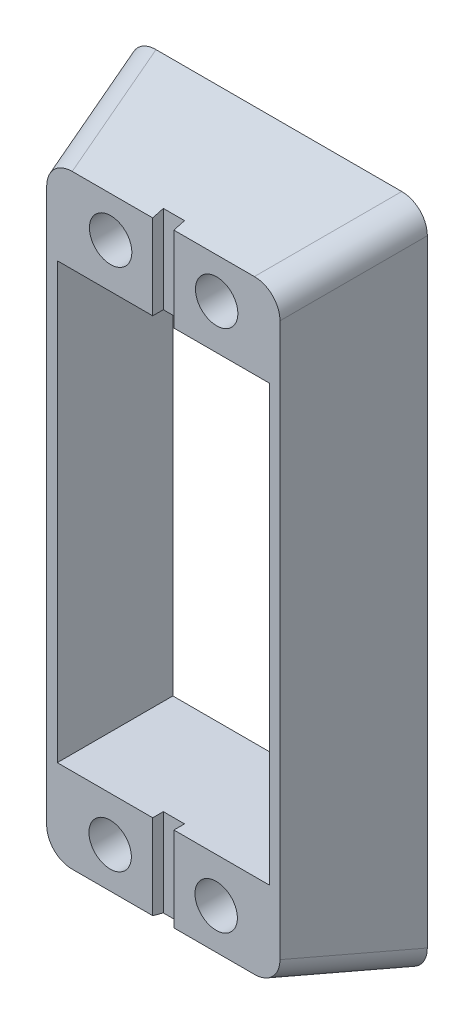
from build123d import *

# Parameters (mm, degrees)
SKETCH1_W           = 28
SKETCH1_H           = 63
SKETCH1_W_2         = 20
SKETCH1_H_2         = 41
BOSS_EXTRUDE1_DEPTH = 10.9
SKETCH2_R           = 2
CUT_EXTRUDE1_DEPTH  = 45.904036567
CHAMFER1_SIZE       = 10.9
CHAMFER1_SIZE_2     = 3
SKETCH3_W           = 2
SKETCH3_H           = 1
CUT_EXTRUDE2_DEPTH  = 65.248521384
FILLET1_R           = 2.5


with BuildPart() as part:
    # Sketch1 → Boss-Extrude1 (new body)
    with BuildSketch(Plane.XY):
        with Locations((0, 9.75)):
            Rectangle(SKETCH1_W, SKETCH1_H)
        with Locations((0, 9.75)):
            Rectangle(SKETCH1_W_2, SKETCH1_H_2, mode=Mode.SUBTRACT)
    extrude(amount=BOSS_EXTRUDE1_DEPTH)

    # Sketch2 → Cut-Extrude1 (cut, through all)
    with BuildSketch(Plane(origin=(0, 0, 0), x_dir=(-1, 0, 0), z_dir=(0, 0, -1))):
        with Locations((5.013249621, -14.95)):
            Circle(SKETCH2_R)
        with Locations((-4.986750379, -14.95)):
            Circle(SKETCH2_R)
        with Locations((-5.030525248, 34.45)):
            Circle(SKETCH2_R)
        with Locations((4.969474752, 34.45)):
            Circle(SKETCH2_R)
    extrude(amount=-CUT_EXTRUDE1_DEPTH, mode=Mode.SUBTRACT)

    # Chamfer1
    # the kernel refuses this chamfer: 10.9, 3 mm, written as the material it takes off along each edge
    with BuildSketch(Plane(origin=(14, -50.052400278, 10.9), x_dir=(0.010219792224504668, 0, -0.9999477765598), z_dir=(0, 1, 0)), Plane(origin=(-14, 69.552400278, 10.9), x_dir=(-0.010219792224504668, 0, -0.9999477765598), z_dir=(0, -1, 0))) as chamfer1_piece_1:
        Polygon((CHAMFER1_SIZE * 0.99994777656, CHAMFER1_SIZE * 0.0102197922245), (-CHAMFER1_SIZE_2 * 0.0102197922245, CHAMFER1_SIZE_2 * 0.99994777656), (0, 0), align=None)
    extrude(amount=119.604800556, mode=Mode.SUBTRACT)
    with BuildSketch(Plane(origin=(-42.302400278, -21.75, 10.9), x_dir=(0, -0.010219792224504825, -0.9999477765598), z_dir=(1, 0, 0))) as chamfer1_piece_2:
        Polygon((CHAMFER1_SIZE * 0.99994777656, CHAMFER1_SIZE * 0.0102197922245), (-CHAMFER1_SIZE_2 * 0.0102197922245, CHAMFER1_SIZE_2 * 0.99994777656), (0, 0), align=None)
    extrude(amount=84.604800556, mode=Mode.SUBTRACT)
    with BuildSketch(Plane(origin=(42.302400278, 41.25, 10.9), x_dir=(0, -0.9910207476808653, 0.1337081809989902), z_dir=(-1, 0, 0))) as chamfer1_piece_3:
        Polygon((CHAMFER1_SIZE_2 * 0.991020747681, -CHAMFER1_SIZE_2 * 0.133708180999), (-CHAMFER1_SIZE * 0.133708180999, -CHAMFER1_SIZE * 0.991020747681), (0, 0), align=None)
    extrude(amount=84.604800556, mode=Mode.SUBTRACT)

    # Sketch3 → Cut-Extrude2 (cut, through all)
    with BuildSketch(Plane(origin=(0, 40, 0), x_dir=(1, 0, 0), z_dir=(0, 1, 0))):
        with Locations((0, -10.4)):
            Rectangle(SKETCH3_W, SKETCH3_H)
    extrude(amount=-CUT_EXTRUDE2_DEPTH, mode=Mode.SUBTRACT)

    # Fillet1
    fillet1_edges = [part.edges().sort_by_distance(p)[0] for p in [
        (-12.5, -20.25, 5.45),
        (-12.5, 39.75, 5.45),
        (12.5, -20.25, 5.45),
        (12.5, 39.75, 5.45),
    ]]
    fillet(fillet1_edges, radius=FILLET1_R)


solid = part.part
